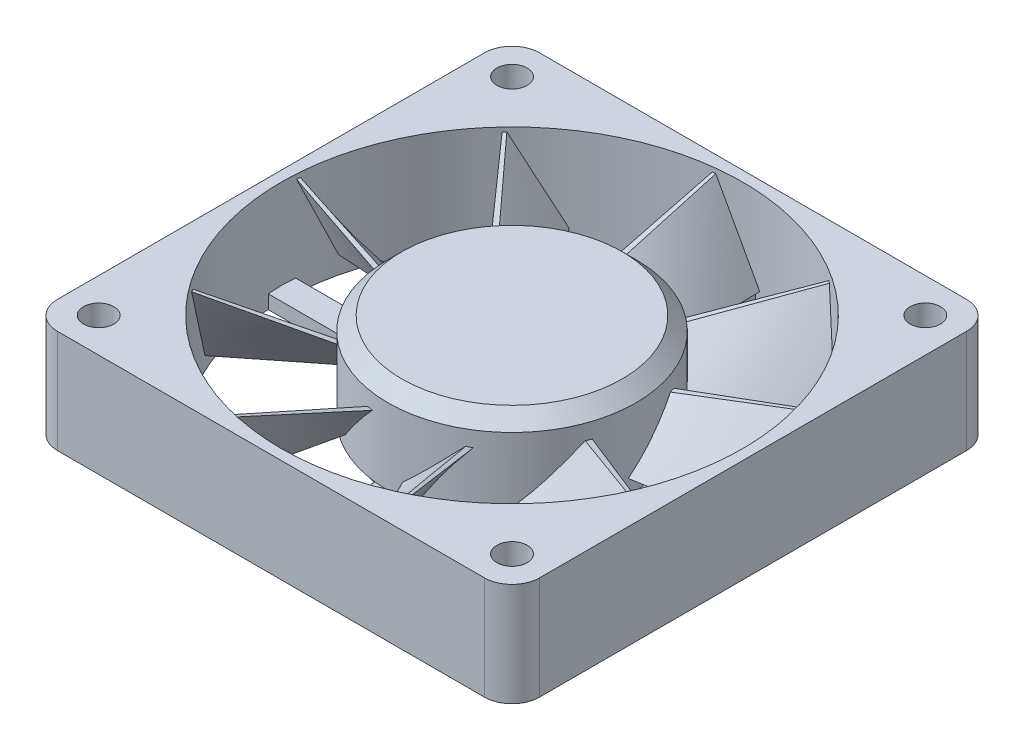
from build123d import *

# Parameters (mm, degrees)
SKETCH1_R           = 33.5
SKETCH1_R_2         = 2.2
BOSS_EXTRUDE1_DEPTH = 15
BOSS_EXTRUDE2_DEPTH = 2
SKETCH3_R           = 18
BOSS_EXTRUDE3_DEPTH = 13
CHAMFER1_SIZE       = 2
CIRPATTERN33_COUNT  = 9


with BuildPart() as part:
    # Sketch1 → Boss-Extrude1 (new body)
    with BuildSketch(Plane(origin=(0, 0, 0), x_dir=(1, 0, 0), z_dir=(0, 1, 0))):
        with BuildLine():
            Line((-31, 35), (31, 35))
            ThreePointArc((31, 35), (33.828427125, 33.828427125), (35, 31))
            Line((35, 31), (35, -31))
            ThreePointArc((35, -31), (33.828427125, -33.828427125), (31, -35))
            Line((31, -35), (-31, -35))
            ThreePointArc((-31, -35), (-33.828427125, -33.828427125), (-35, -31))
            Line((-35, -31), (-35, 31))
            ThreePointArc((-35, 31), (-33.828427125, 33.828427125), (-31, 35))
        make_face()
        Circle(SKETCH1_R, mode=Mode.SUBTRACT)
        with Locations((-30, 30)):
            Circle(SKETCH1_R_2, mode=Mode.SUBTRACT)
        with Locations((30, 30)):
            Circle(SKETCH1_R_2, mode=Mode.SUBTRACT)
        with Locations((30, -30)):
            Circle(SKETCH1_R_2, mode=Mode.SUBTRACT)
        with Locations((-30, -30)):
            Circle(SKETCH1_R_2, mode=Mode.SUBTRACT)
    extrude(amount=BOSS_EXTRUDE1_DEPTH)


with BuildPart() as body_2:
    # Sketch2 → Boss-Extrude2 (new body)
    with BuildSketch(Plane(origin=(0, 0, 0), x_dir=(1, 0, 0), z_dir=(0, 1, 0))):
        with BuildLine():
            Line((-1.985467564, 33.380107404), (0, 33.5))
            Line((0, 33.5), (1.985467564, 33.380107404))
            Line((1.985467564, 33.380107404), (1.985467564, 16.380107404))
            ThreePointArc((1.985467564, 16.380107404), (11.66726189, 11.66726189), (16.380107404, 1.985467564))
            Line((16.380107404, 1.985467564), (33.380107404, 1.985467564))
            Line((33.380107404, 1.985467564), (33.5, 0))
            Line((33.5, 0), (33.380107404, -1.985467564))
            Line((33.380107404, -1.985467564), (16.380107404, -1.985467564))
            ThreePointArc((16.380107404, -1.985467564), (11.66726189, -11.66726189), (1.985467564, -16.380107404))
            Line((1.985467564, -16.380107404), (1.985467564, -33.380107404))
            Line((1.985467564, -33.380107404), (0, -33.5))
            Line((0, -33.5), (-1.985467564, -33.380107404))
            Line((-1.985467564, -33.380107404), (-1.985467564, -16.380107404))
            ThreePointArc((-1.985467564, -16.380107404), (-11.66726189, -11.66726189), (-16.380107404, -1.985467564))
            Line((-16.380107404, -1.985467564), (-33.380107404, -1.985467564))
            Line((-33.380107404, -1.985467564), (-33.5, 0))
            Line((-33.5, 0), (-33.380107404, 1.985467564))
            Line((-33.380107404, 1.985467564), (-16.380107404, 1.985467564))
            ThreePointArc((-16.380107404, 1.985467564), (-11.66726189, 11.66726189), (-1.985467564, 16.380107404))
            Line((-1.985467564, 16.380107404), (-1.985467564, 33.380107404))
        make_face()
    extrude(amount=BOSS_EXTRUDE2_DEPTH)

    # Sketch3 → Boss-Extrude3 (add)
    with BuildSketch(Plane(origin=(0, 2, 0), x_dir=(1, 0, 0), z_dir=(0, 1, 0))):
        Circle(SKETCH3_R)
    extrude(amount=BOSS_EXTRUDE3_DEPTH)

    # Chamfer1
    chamfer1_edges = [body_2.edges().sort_by_distance(p)[0] for p in [
        (-18, 15, 0),
    ]]
    chamfer(chamfer1_edges, length=CHAMFER1_SIZE)

    # Sketch8 → Loft2 section 0
    with BuildSketch(Plane(origin=(0, 0, -33), x_dir=(-1, 0, 0), z_dir=(0, 0, -1))):
        with BuildLine():
            Line((-2.964308485, 2.962946086), (-1.382716758, 2.962946086))
            Line((-1.382716758, 2.962946086), (3.90507934, 14.59289777))
            Line((3.90507934, 14.59289777), (3.419420465, 14.59289777))
            Line((3.419420465, 14.59289777), (-2.964308485, 2.962946086))
        make_face()
    # Sketch7 → Loft2 section 1
    with BuildSketch(Plane(origin=(0, 0, -17), x_dir=(-1, 0, 0), z_dir=(0, 0, -1))):
        with BuildLine():
            Line((3.003785407, 10.615866262), (3.806080572, 10.615866262))
            Line((3.806080572, 10.615866262), (-2.159284163, 4.051963863))
            Line((-2.159284163, 4.051963863), (-4.236780151, 4.051963863))
            Line((-4.236780151, 4.051963863), (3.003785407, 10.615866262))
        make_face()
    loft2 = loft()

    # CirPattern33: Loft2 ×9 about axis
    cirpattern33_axis = Axis((0, 15, 0), (0, -1, 0))
    for i in range(1, CIRPATTERN33_COUNT):
        add(loft2.rotate(cirpattern33_axis, i * 360 / CIRPATTERN33_COUNT))


solid = Compound([part.part, body_2.part])
